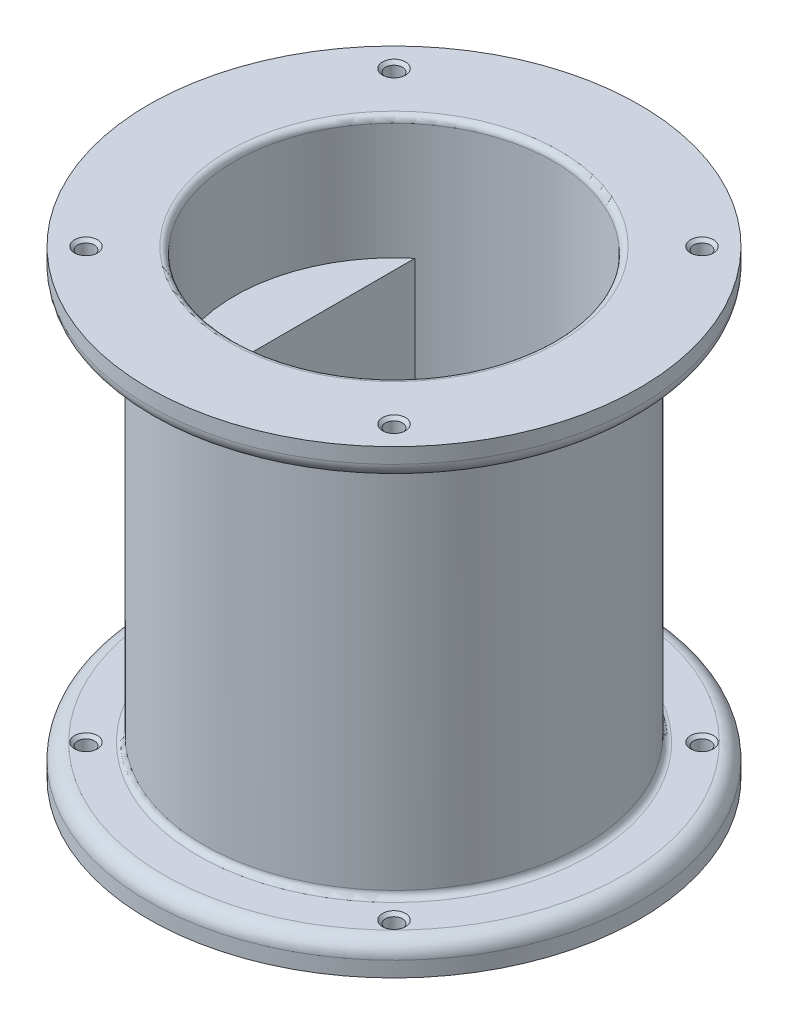
from build123d import *

# Parameters (mm, degrees)
SKETCH1_R                    = 62
SKETCH1_R_2                  = 52
BOSS_EXTRUDE1_DEPTH          = 150
BOSS_EXTRUDE2_DEPTH          = 120
BOSS_EXTRUDE3_DEPTH          = 110
SKETCH5_R                    = 80
SKETCH5_R_2                  = 62
BOSS_EXTRUDE4_DEPTH          = 10
BOSS_EXTRUDE5_START          = -10
SKETCH6_R                    = 80
SKETCH6_R_2                  = 62
BOSS_EXTRUDE5_DEPTH          = 10
SKETCH7_R                    = 2.75
CUT_EXTRUDE1_DEPTH           = 188.882942281
CHAMFER1_SIZE                = 1
CIRPATTERN1_COUNT            = 4
CHAMFER1_OF_CIRPATTERN1_SIZE = 1
FILLET1_R                    = 2
FILLET2_R                    = 2
FILLET3_R                    = 5


with BuildPart() as part:
    # Sketch1 → Boss-Extrude1 (new body)
    with BuildSketch(Plane(origin=(0, 0, 0), x_dir=(1, 0, 0), z_dir=(0, 1, 0))):
        Circle(SKETCH1_R)
        Circle(SKETCH1_R_2, mode=Mode.SUBTRACT)
    extrude(amount=BOSS_EXTRUDE1_DEPTH)

    # Sketch2 → Boss-Extrude2 (add)
    with BuildSketch(Plane(origin=(0, 0, 0), x_dir=(1, 0, 0), z_dir=(0, 1, 0))):
        with BuildLine():
            Line((26.057628442, 45), (26.057628442, -45))
            ThreePointArc((26.057628442, -45), (52, 0), (26.057628442, 45))
        make_face()
    extrude(amount=BOSS_EXTRUDE2_DEPTH)

    # Sketch4 → Boss-Extrude3 (add)
    with BuildSketch(Plane.XZ):
        with BuildLine():
            Line((-33.226495452, 40), (-33.226495452, -40))
            ThreePointArc((-33.226495452, -40), (-52, 0), (-33.226495452, 40))
        make_face()
    extrude(amount=-BOSS_EXTRUDE3_DEPTH)

    # Sketch5 → Boss-Extrude4 (add)
    with BuildSketch(Plane.XZ):
        Circle(SKETCH5_R)
        Circle(SKETCH5_R_2, mode=Mode.SUBTRACT)
    extrude(amount=-BOSS_EXTRUDE4_DEPTH)

    # Sketch6 → Boss-Extrude5 (add)
    with BuildSketch(Plane(origin=(0, 150, 0), x_dir=(1, 0, 0), z_dir=(0, 1, 0)).offset(BOSS_EXTRUDE5_START)):
        Circle(SKETCH6_R)
        Circle(SKETCH6_R_2, mode=Mode.SUBTRACT)
    extrude(amount=BOSS_EXTRUDE5_DEPTH)

    # Sketch7 → Cut-Extrude1 (cut, through all)
    with BuildSketch(Plane(origin=(0, 150, 0), x_dir=(1, 0, 0), z_dir=(0, 1, 0))):
        with Locations((50.204581464, 50.204581464)):
            Circle(SKETCH7_R)
    cut_extrude1 = extrude(amount=-CUT_EXTRUDE1_DEPTH, mode=Mode.SUBTRACT)

    # Chamfer1
    chamfer1_edges = [part.edges().sort_by_distance(p)[0] for p in [
        (47.454581464, 150, -50.204581464),
        (47.454581464, 10, -50.204581464),
    ]]
    chamfer(chamfer1_edges, length=CHAMFER1_SIZE)

    # CirPattern1: Cut-Extrude1 ×4 about axis
    cirpattern1_axis = Axis((0, 150, 0), (0, 1, 0))
    for i in range(1, CIRPATTERN1_COUNT):
        add(cut_extrude1.rotate(cirpattern1_axis, i * 360 / CIRPATTERN1_COUNT), mode=Mode.SUBTRACT)

    # Chamfer1 of CirPattern1
    chamfer1_of_cirpattern1_edges = [part.edges().sort_by_distance(p)[0] for p in [
        (-50.204581464, 150, -47.454581464),
        (-50.204581464, 10, -47.454581464),
        (-47.454581464, 150, 50.204581464),
        (-47.454581464, 10, 50.204581464),
        (50.204581464, 150, 47.454581464),
        (50.204581464, 10, 47.454581464),
    ]]
    chamfer(chamfer1_of_cirpattern1_edges, length=CHAMFER1_OF_CIRPATTERN1_SIZE)

    # Fillet1
    fillet1_edges = [part.edges().sort_by_distance(p)[0] for p in [
        (-52, 150, 0),
    ]]
    fillet(fillet1_edges, radius=FILLET1_R)

    # Fillet2
    fillet2_edges = [part.edges().sort_by_distance(p)[0] for p in [
        (-62, 10, 0),
        (-62, 140, 0),
    ]]
    fillet(fillet2_edges, radius=FILLET2_R)

    # Fillet3
    fillet3_edges = [part.edges().sort_by_distance(p)[0] for p in [
        (-80, 10, 0),
        (-80, 140, 0),
    ]]
    fillet(fillet3_edges, radius=FILLET3_R)


solid = part.part
